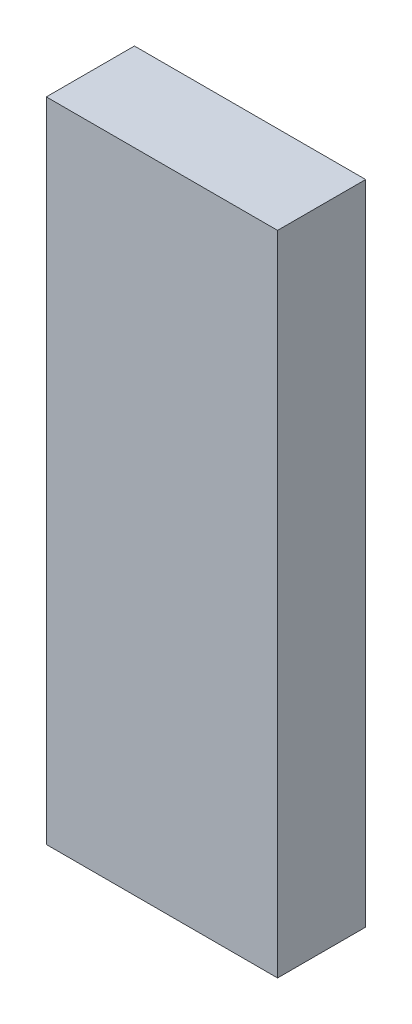
from build123d import *

# Parameters (mm, degrees)
SKETCH1_W           = 25
SKETCH1_H           = 70
BOSS_EXTRUDE1_DEPTH = 9.525


with BuildPart() as part:
    # Sketch1 → Boss-Extrude1 (new body)
    with BuildSketch(Plane.XY):
        Rectangle(SKETCH1_W, SKETCH1_H)
    extrude(amount=BOSS_EXTRUDE1_DEPTH)


solid = part.part
